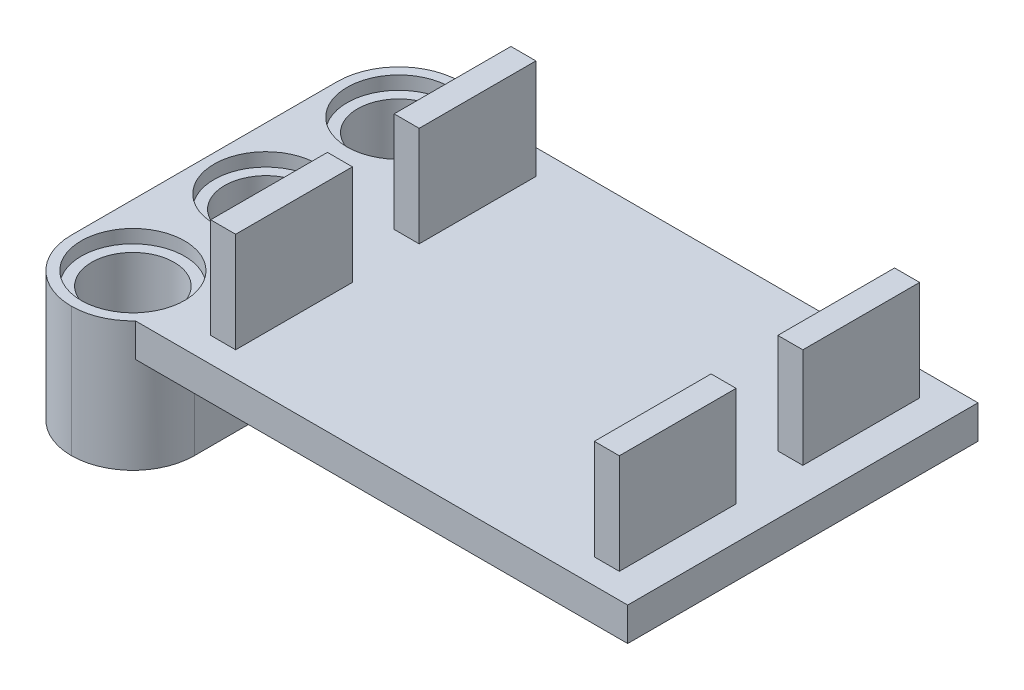
from build123d import *

# Parameters (mm, degrees)
SKETCH1_W           = 28.5
SKETCH1_H           = 21
BOSS_EXTRUDE1_DEPTH = 2
SKETCH2_W           = 1.5
SKETCH2_H           = 7
BOSS_EXTRUDE2_DEPTH = 6
SKETCH3_W           = 23.32
SKETCH3_H           = 7.76
BOSS_EXTRUDE3_DEPTH = 7.38
SKETCH4_R           = 2.472
CUT_EXTRUDE1_DEPTH  = 7.76
SKETCH5_R           = 3.1
CUT_EXTRUDE2_DEPTH  = 0.8
CUT_EXTRUDE3_START  = -0.8
SKETCH6_R           = 3.1
CUT_EXTRUDE3_DEPTH  = 0.8
FILLET1_R           = 3.69


with BuildPart() as part:
    # Sketch1 → Boss-Extrude1 (new body)
    with BuildSketch(Plane(origin=(0, 0, 0), x_dir=(1, 0, 0), z_dir=(0, 1, 0))):
        with Locations((14.25, 10.5)):
            Rectangle(SKETCH1_W, SKETCH1_H)
    extrude(amount=BOSS_EXTRUDE1_DEPTH)

    # Sketch2 → Boss-Extrude2 (add)
    with BuildSketch(Plane(origin=(0, 2, 0), x_dir=(1, 0, 0), z_dir=(0, 1, 0))):
        with Locations((2.75, 16)):
            Rectangle(SKETCH2_W, SKETCH2_H)
        with Locations((2.75, 5)):
            Rectangle(SKETCH2_W, SKETCH2_H)
        with Locations((25.75, 16)):
            Rectangle(SKETCH2_W, SKETCH2_H)
        with Locations((25.75, 5)):
            Rectangle(SKETCH2_W, SKETCH2_H)
    extrude(amount=BOSS_EXTRUDE2_DEPTH)

    # Sketch3 → Boss-Extrude3 (add)
    with BuildSketch(Plane.ZY):
        with Locations((-10.5, -1.88)):
            Rectangle(SKETCH3_W, SKETCH3_H)
    extrude(amount=BOSS_EXTRUDE3_DEPTH)

    # Sketch4 → Cut-Extrude1 (cut)
    with BuildSketch(Plane.XZ.offset(5.76)):
        with Locations(Location((-3.69, -2.53, 0), (0, 0, 270))):
            Circle(SKETCH4_R)
        with Locations(Location((-3.69, -10.5, 0), (0, 0, 270))):
            Circle(SKETCH4_R)
        with Locations(Location((-3.69, -18.47, 0), (0, 0, 270))):
            Circle(SKETCH4_R)
    extrude(amount=-CUT_EXTRUDE1_DEPTH, mode=Mode.SUBTRACT)

    # Sketch5 → Cut-Extrude2 (cut)
    with BuildSketch(Plane.XZ.offset(5.76)):
        with Locations(Location((-3.69, -2.53, 0), (0, 0, 270))):
            Circle(SKETCH5_R)
        with Locations(Location((-3.69, -10.5, 0), (0, 0, 270))):
            Circle(SKETCH5_R)
        with Locations(Location((-3.69, -18.47, 0), (0, 0, 270))):
            Circle(SKETCH5_R)
    extrude(amount=-CUT_EXTRUDE2_DEPTH, mode=Mode.SUBTRACT)

    # Sketch6 → Cut-Extrude3 (cut)
    with BuildSketch(Plane(origin=(0, 2, 0), x_dir=(1, 0, 0), z_dir=(0, 1, 0)).offset(CUT_EXTRUDE3_START)):
        with Locations(Location((-3.69, 10.5, 0), (0, 0, 90))):
            Circle(SKETCH6_R)
        with Locations(Location((-3.69, 18.47, 0), (0, 0, 90))):
            Circle(SKETCH6_R)
        with Locations(Location((-3.69, 2.53, 0), (0, 0, 90))):
            Circle(SKETCH6_R)
    extrude(amount=CUT_EXTRUDE3_DEPTH, mode=Mode.SUBTRACT)

    # Fillet1
    fillet1_edges = [part.edges().sort_by_distance(p)[0] for p in [
        (-7.38, -1.88, -22.16),
        (0, -1.88, -22.16),
        (0, -1.88, 1.16),
        (-7.38, -1.88, 1.16),
    ]]
    fillet(fillet1_edges, radius=FILLET1_R - 0.0001)  # a hair under: the kernel refuses the full size


solid = part.part
